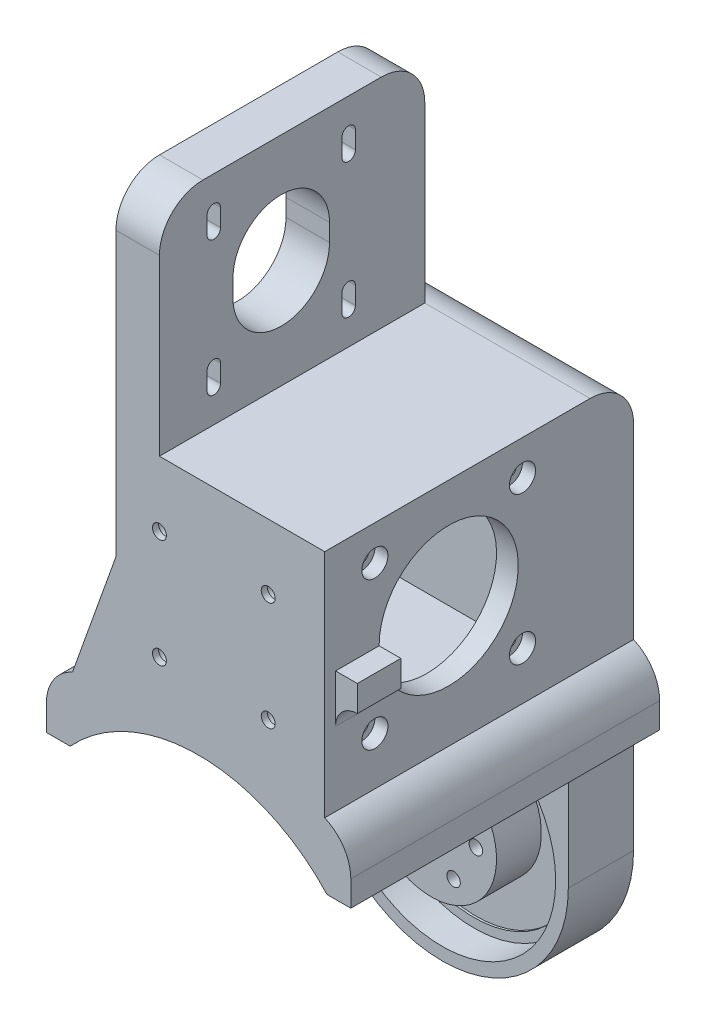
from build123d import *

# Parameters (mm, degrees)
SKETCH_1_R           = 29
EXTRUDE_1_DEPTH      = 15
SKETCH_2_R           = 1.55
SKETCH_2_R_2         = 5.1
CUT_EXTRUDE_1_DEPTH  = 44.669211122
EXTRUDE_2_DEPTH      = 71
SKETCH_12_W          = 70
SKETCH_12_H          = 15
EXTRUDE_3_DEPTH      = 71
FILLET_5_R           = 10
SKETCH_22_W          = 71
SKETCH_22_H          = 103
CUT_EXTRUDE_11_DEPTH = 10
SKETCH_4_R           = 40
CUT_EXTRUDE_2_DEPTH  = 56
SKETCH_5_R           = 16
SKETCH_5_R_2         = 1.55
CUT_EXTRUDE_3_DEPTH  = 171.241005636
SKETCH_6_W           = 42.2
SKETCH_6_H           = 42.2
CUT_EXTRUDE_4_DEPTH  = 43
CUT_EXTRUDE_5_DEPTH  = 171.241005636
SKETCH_8_W           = 10
SKETCH_8_H           = 50
CUT_EXTRUDE_6_DEPTH  = 10
FILLET_1_R           = 10
FILLET_2_R           = 10
FILLET_3_R           = 10
SKETCH_17_R          = 26.1
CUT_EXTRUDE_7_DEPTH  = 7.3
SKETCH_18_R          = 24
CUT_EXTRUDE_8_DEPTH  = 0.5
EXTRUDE_START        = 10.3
SKETCH_19_R          = 15
SKETCH_19_R_2        = 1.55
SKETCH_19_R_3        = 5.1
EXTRUDE_5_DEPTH      = 10.3
SKETCH_20_R          = 3
CUT_EXTRUDE_9_DEPTH  = 3
SKETCH_23_R          = 1.6
CUT_EXTRUDE_12_DEPTH = 163.157207672
SKETCH_26_R          = 2.1
CUT_EXTRUDE_13_DEPTH = 6
SKETCH_27_R          = 3
CUT_EXTRUDE_14_DEPTH = 3
SKETCH_28_W          = 10
SKETCH_28_H          = 6
EXTRUDE_6_DEPTH      = 5
FILLET_6_R           = 5
EXTRUDE_7_DEPTH      = 10
EXTRUDE_8_DEPTH      = 6


# Some blends are built 0.0001 mm under size
with BuildPart() as part:
    # 草图1 → 凸台-拉伸1 (new body)
    with BuildSketch(Plane.XY):
        Circle(SKETCH_1_R)
    extrude(amount=EXTRUDE_1_DEPTH)

    # 草图2 → 切除-拉伸1 (cut, through all)
    with BuildSketch(Plane.XY.offset(15)):
        with Locations((-5.125, 8.876760389)):
            Circle(SKETCH_2_R)
        with Locations((5.125, 8.876760389)):
            Circle(SKETCH_2_R)
        with Locations((10.25, 0)):
            Circle(SKETCH_2_R)
        with Locations((5.125, -8.876760389)):
            Circle(SKETCH_2_R)
        Circle(SKETCH_2_R_2)
        with Locations((-5.125, -8.876760389)):
            Circle(SKETCH_2_R)
        with Locations((-10.25, 0)):
            Circle(SKETCH_2_R)
    extrude(amount=-CUT_EXTRUDE_1_DEPTH, mode=Mode.SUBTRACT)

    # 草图17 → 切除-拉伸7 (cut)
    with BuildSketch(Plane.XY.offset(15)):
        Circle(SKETCH_17_R)
    extrude(amount=-CUT_EXTRUDE_7_DEPTH, mode=Mode.SUBTRACT)

    # 草图18 → 切除-拉伸8 (cut)
    with BuildSketch(Plane.XY.offset(7.7)):
        Circle(SKETCH_18_R)
    extrude(amount=-CUT_EXTRUDE_8_DEPTH, mode=Mode.SUBTRACT)


with BuildPart() as body_2:
    # 草图3 → 凸台-拉伸2 (new body)
    with BuildSketch(Plane.XY):
        with BuildLine():
            ThreePointArc((-29, 0), (0, 29), (29, 0))
            Line((29, 0), (29, 95))
            Line((29, 95), (-9, 95))
            Line((-9, 95), (-9, 145))
            Line((-9, 145), (-29, 145))
            Line((-29, 145), (-29, 0))
        make_face()
    extrude(amount=EXTRUDE_2_DEPTH)

    # 草图12 → 凸台-拉伸3 (add)
    with BuildSketch(Plane.XY.offset(71)):
        with Locations((0, 34.5)):
            Rectangle(SKETCH_12_W, SKETCH_12_H)
    extrude(amount=-EXTRUDE_3_DEPTH)

    # 圆角5
    # the kernel refuses this fillet: 10 mm, written as the material it takes off along each edge
    with BuildSketch(Plane(origin=(35, 42, 93.912878475), x_dir=(0, -1, 0), z_dir=(0, 0, -1))) as fillet_5_piece_1:
        with BuildLine():
            CenterArc((9.16515139, 10), FILLET_5_R, 203.578178478, 66.421821522)
            Line((0, 6), (-0.183303028, 5.92))
            ThreePointArc((-0.183303028, 5.92), (-0.2, 3), (-0.2, 0))
            Line((-0.2, 0), (0, -0.2))
            Line((0, -0.2), (9.16515139, -0.2))
            Line((9.16515139, -0.2), (9.16515139, 0))
        make_face()
    extrude(amount=116.82575695, mode=Mode.SUBTRACT)
    with BuildSketch(Plane(origin=(-35, 42, 93.912878475), x_dir=(0, -1, 0), z_dir=(0, 0, -1))) as fillet_5_piece_2:
        with BuildLine():
            CenterArc((9.16515139, -10), FILLET_5_R, 90, 66.421821522)
            Line((0, -6), (-0.183303028, -5.92))
            ThreePointArc((-0.183303028, -5.92), (-0.2, -3), (-0.2, 0))
            Line((-0.2, 0), (0, 0.2))
            Line((0, 0.2), (9.16515139, 0.2))
            Line((9.16515139, 0.2), (9.16515139, 0))
        make_face()
    extrude(amount=116.82575695, mode=Mode.SUBTRACT)

    # 草图22 → 切除-拉伸11 (cut)
    with BuildSketch(Plane.ZY.offset(29)):
        with Locations((35.5, 93.5)):
            Rectangle(SKETCH_22_W, SKETCH_22_H)
    extrude(amount=-CUT_EXTRUDE_11_DEPTH, mode=Mode.SUBTRACT)

    # 草图4 → 切除-拉伸2 (cut)
    with BuildSketch(Plane.XY.offset(71)):
        Circle(SKETCH_4_R)
    extrude(amount=-CUT_EXTRUDE_2_DEPTH, mode=Mode.SUBTRACT)

    # 草图5 → 切除-拉伸3 (cut, through all)
    with BuildSketch(Plane.ZY.offset(19)):
        with Locations(Location((42.5, 70, 0), (0, 0, 270))):
            Circle(SKETCH_5_R)
        with Locations(Location((25.529437252, 86.970562748, 0), (0, 0, 270))):
            Circle(SKETCH_5_R_2)
        with Locations(Location((59.470562748, 86.970562748, 0), (0, 0, 270))):
            Circle(SKETCH_5_R_2)
        with Locations(Location((59.470562748, 53.029437252, 0), (0, 0, 270))):
            Circle(SKETCH_5_R_2)
        with Locations(Location((25.529437252, 53.029437252, 0), (0, 0, 270))):
            Circle(SKETCH_5_R_2)
    extrude(amount=-CUT_EXTRUDE_3_DEPTH, mode=Mode.SUBTRACT)

    # 草图6 → 切除-拉伸4 (cut)
    with BuildSketch(Plane.ZY.offset(19)):
        with Locations((42.5, 70)):
            Rectangle(SKETCH_6_W, SKETCH_6_H)
    extrude(amount=-CUT_EXTRUDE_4_DEPTH, mode=Mode.SUBTRACT)

    # 草图7 → 切除-拉伸5 (cut, through all)
    with BuildSketch(Plane.ZY.offset(19)):
        with BuildLine():
            Line((56.95, 137.497499937), (56.95, 133.497499937))
            ThreePointArc((56.95, 133.497499937), (58.5, 131.947499937), (60.05, 133.497499937))
            Line((60.05, 133.497499937), (60.05, 137.497499937))
            ThreePointArc((60.05, 137.497499937), (58.5, 139.047499937), (56.95, 137.497499937))
        make_face()
        with BuildLine():
            Line((54.1, 121.997499937), (54.1, 117.997499937))
            ThreePointArc((54.1, 117.997499937), (43, 106.897499937), (31.9, 117.997499937))
            Line((31.9, 117.997499937), (31.9, 121.997499937))
            ThreePointArc((31.9, 121.997499937), (43, 133.097499937), (54.1, 121.997499937))
        make_face()
        with BuildLine():
            Line((29.05, 137.497499937), (29.05, 133.497499937))
            ThreePointArc((29.05, 133.497499937), (27.5, 131.947499937), (25.95, 133.497499937))
            Line((25.95, 133.497499937), (25.95, 137.497499937))
            ThreePointArc((25.95, 137.497499937), (27.5, 139.047499937), (29.05, 137.497499937))
        make_face()
        with BuildLine():
            Line((56.95, 106.497499937), (56.95, 102.497499937))
            ThreePointArc((56.95, 102.497499937), (58.5, 100.947499937), (60.05, 102.497499937))
            Line((60.05, 102.497499937), (60.05, 106.497499937))
            ThreePointArc((60.05, 106.497499937), (58.5, 108.047499937), (56.95, 106.497499937))
        make_face()
        with BuildLine():
            Line((25.95, 106.497499937), (25.95, 102.497499937))
            ThreePointArc((25.95, 102.497499937), (27.5, 100.947499937), (29.05, 102.497499937))
            Line((29.05, 102.497499937), (29.05, 106.497499937))
            ThreePointArc((29.05, 106.497499937), (27.5, 108.047499937), (25.95, 106.497499937))
        make_face()
    extrude(amount=-CUT_EXTRUDE_5_DEPTH, mode=Mode.SUBTRACT)

    # 草图8 → 切除-拉伸6 (cut)
    with BuildSketch(Plane(origin=(0, 0, 0), x_dir=(-1, 0, 0), z_dir=(0, 0, -1))):
        with Locations((14, 120)):
            Rectangle(SKETCH_8_W, SKETCH_8_H)
    extrude(amount=-CUT_EXTRUDE_6_DEPTH, mode=Mode.SUBTRACT)

    # 圆角1
    fillet_1_edges = [body_2.edges().sort_by_distance(p)[0] for p in [
        (5, 95, 0),
    ]]
    fillet(fillet_1_edges, radius=FILLET_1_R)

    # 圆角2
    fillet_2_edges = [body_2.edges().sort_by_distance(p)[0] for p in [
        (-14, 145, 10),
    ]]
    fillet(fillet_2_edges, radius=FILLET_2_R)

    # 圆角3
    fillet_3_edges = [body_2.edges().sort_by_distance(p)[0] for p in [
        (-14, 145, 71),
    ]]
    fillet(fillet_3_edges, radius=FILLET_3_R)


    add(part.part)  # 凸台-拉伸5 merges part
    # 草图19 → 凸台-拉伸5 (add)
    with BuildSketch(Plane.XY.offset(7.2).offset(EXTRUDE_START)):
        with Locations(Location((0, 0, 0), (0, 0, 180))):
            Circle(SKETCH_19_R)
        with Locations((-5.125, -8.876760389)):
            Circle(SKETCH_19_R_2, mode=Mode.SUBTRACT)
        with Locations((5.125, -8.876760389)):
            Circle(SKETCH_19_R_2, mode=Mode.SUBTRACT)
        with Locations((10.25, 0)):
            Circle(SKETCH_19_R_2, mode=Mode.SUBTRACT)
        Circle(SKETCH_19_R_3, mode=Mode.SUBTRACT)
        with Locations((5.125, 8.876760389)):
            Circle(SKETCH_19_R_2, mode=Mode.SUBTRACT)
        with Locations((-5.125, 8.876760389)):
            Circle(SKETCH_19_R_2, mode=Mode.SUBTRACT)
        with Locations((-10.25, 0)):
            Circle(SKETCH_19_R_2, mode=Mode.SUBTRACT)
    extrude(amount=-EXTRUDE_5_DEPTH)

    # 草图20 → 切除-拉伸9 (cut)
    with BuildSketch(Plane(origin=(0, 0, 0), x_dir=(-1, 0, 0), z_dir=(0, 0, -1))):
        with Locations((-5.125, 8.876760389)):
            Circle(SKETCH_20_R)
        with Locations((5.125, 8.876760389)):
            Circle(SKETCH_20_R)
        with Locations((-10.25, 0)):
            Circle(SKETCH_20_R)
        with Locations((-5.125, -8.876760389)):
            Circle(SKETCH_20_R)
        with Locations((5.125, -8.876760389)):
            Circle(SKETCH_20_R)
        with Locations((10.25, 0)):
            Circle(SKETCH_20_R)
    extrude(amount=-CUT_EXTRUDE_9_DEPTH, mode=Mode.SUBTRACT)

    # 草图23 → 切除-拉伸12 (cut, through all)
    with BuildSketch(Plane(origin=(0, 0, 63.6), x_dir=(-1, 0, 0), z_dir=(0, 0, -1))):
        with Locations((-16, 80)):
            Circle(SKETCH_23_R)
        with Locations((9, 80)):
            Circle(SKETCH_23_R)
        with Locations((9, 55)):
            Circle(SKETCH_23_R)
        with Locations((-16, 55)):
            Circle(SKETCH_23_R)
    extrude(amount=-CUT_EXTRUDE_12_DEPTH, mode=Mode.SUBTRACT)

    # 草图26 → 切除-拉伸13 (cut)
    with BuildSketch(Plane(origin=(0, 0, 63.6), x_dir=(-1, 0, 0), z_dir=(0, 0, -1))):
        with Locations((-16, 80)):
            Circle(SKETCH_26_R)
        with Locations((9, 80)):
            Circle(SKETCH_26_R)
        with Locations((-16, 55)):
            Circle(SKETCH_26_R)
        with Locations((9, 55)):
            Circle(SKETCH_26_R)
    extrude(amount=-CUT_EXTRUDE_13_DEPTH, mode=Mode.SUBTRACT)

    # 草图27 → 切除-拉伸14 (cut)
    with BuildSketch(Plane(origin=(29, 0, 0), x_dir=(0, 0, -1), z_dir=(1, 0, 0))):
        with Locations((-59.470562748, 86.970562748)):
            Circle(SKETCH_27_R)
        with Locations((-25.529437252, 86.970562748)):
            Circle(SKETCH_27_R)
        with Locations((-59.470562748, 53.029437252)):
            Circle(SKETCH_27_R)
        with Locations((-25.529437252, 53.029437252)):
            Circle(SKETCH_27_R)
    extrude(amount=-CUT_EXTRUDE_14_DEPTH, mode=Mode.SUBTRACT)

    # 草图28 → 凸台-拉伸6 (add)
    with BuildSketch(Plane(origin=(29, 0, 0), x_dir=(0, 0, -1), z_dir=(1, 0, 0))):
        with Locations((-63.5, 67)):
            Rectangle(SKETCH_28_W, SKETCH_28_H)
    extrude(amount=EXTRUDE_6_DEPTH)

    # 圆角6
    fillet_6_edges = [body_2.edges().sort_by_distance(p)[0] for p in [
        (29, 64, 63.5),
    ]]
    fillet(fillet_6_edges, radius=FILLET_6_R - 0.0001)  # a hair under: the kernel refuses the full size

    # 草图29 → 凸台-拉伸7 (add)
    with BuildSketch(Plane(origin=(0, 0, 0), x_dir=(-1, 0, 0), z_dir=(0, 0, -1))):
        Polygon((19, 70), (29, 42), (19, 42), align=None)
    extrude(amount=-EXTRUDE_7_DEPTH)

    # 草图30 → 凸台-拉伸8 (add)
    with BuildSketch(Plane.XY.offset(71)):
        Polygon((-29, 42), (-19, 70), (-19, 42), align=None)
    extrude(amount=-EXTRUDE_8_DEPTH)


solid = body_2.part
